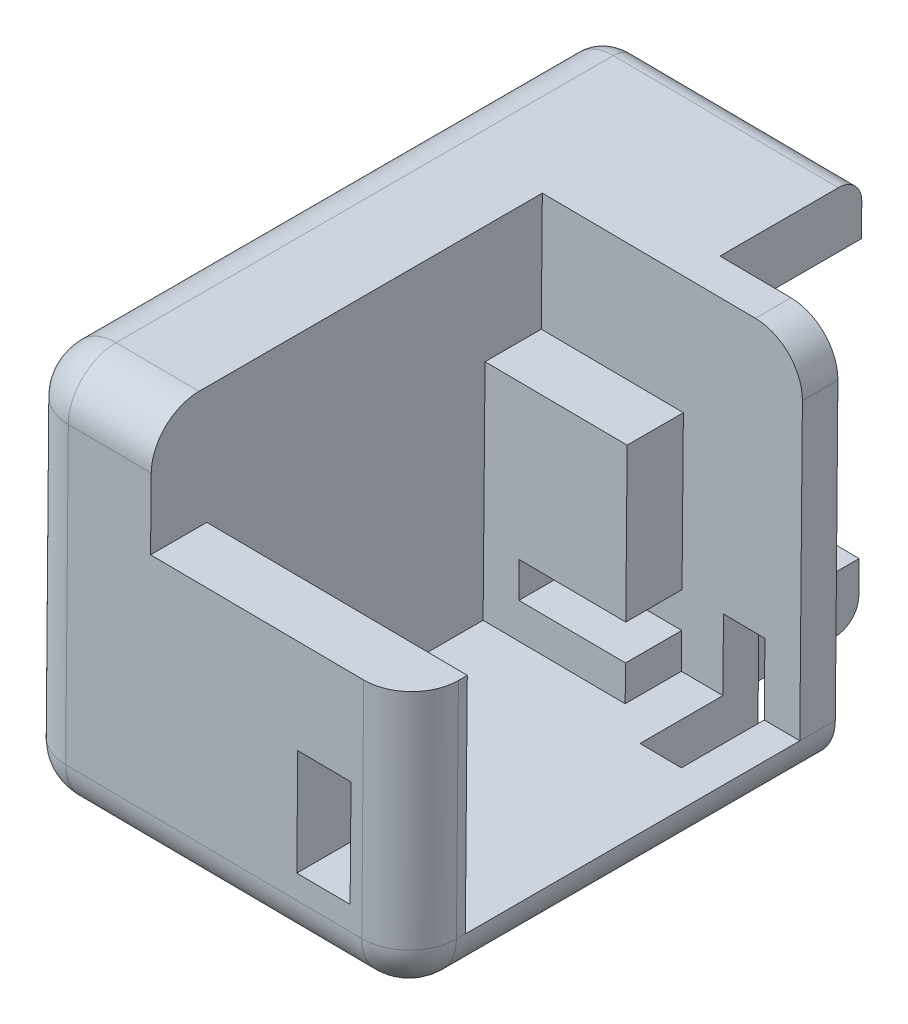
from build123d import *

# Parameters (mm, degrees)
BOSS_EXTRU_1_DEPTH           = 15
ESQUISSE2_W                  = 19
ESQUISSE2_H                  = 23.5
ENL_V_MAT_EXTRU_1_DEPTH      = 12
ESQUISSE6_W                  = 3
ESQUISSE6_H                  = 4.75
ENL_V_MAT_EXTRU_3_DEPTH      = 9
BOSS_EXTRU_2_START           = 33
BOSS_EXTRU_2_DEPTH           = 33
ENL_V_MAT_EXTRU_2_DEPTH      = 12
ESQUISSE7_W                  = 4.75
ESQUISSE7_H                  = 3
ENL_V_MAT_EXTRU_4_DEPTH      = 9
BOSS_EXTRU_3_DEPTH           = 10
ESQUISSE10_W                 = 4.5
ESQUISSE10_H                 = 9
ENL_V_MAT_EXTRU_5_DEPTH      = 10
ESQUISSE11_W                 = 3.5
ESQUISSE11_H                 = 10
ENL_V_MAT_EXTRU_6_DEPTH      = 10
CONG_2_R                     = 2
CONG_3_R                     = 4
CORPS_D_PLACER_COPIER1_ANGLE = 179.5


with BuildPart() as part:
    # Esquisse1 → Boss.-Extru.1 (new body)
    with BuildSketch(Plane(origin=(-30.750548051, -23.495381217, 0), x_dir=(-1, 0, 0), z_dir=(0, 0, -1))):
        with BuildLine():
            Line((-9.363526751, -30.819304804), (-9.363526751, 2.180695196))
            Line((-9.363526751, 2.180695196), (-28.363526751, 2.180695196))
            ThreePointArc((-28.363526751, 2.180695196), (-31.191953876, 1.009122321), (-32.363526751, -1.819304804))
            Line((-32.363526751, -1.819304804), (-32.363526751, -26.819304804))
            ThreePointArc((-32.363526751, -26.819304804), (-31.191953876, -29.647731929), (-28.363526751, -30.819304804))
            Line((-28.363526751, -30.819304804), (-9.363526751, -30.819304804))
        make_face()
    extrude(amount=BOSS_EXTRU_1_DEPTH)

    # Esquisse2 → Enlèv. mat.-Extru.1 (cut)
    with BuildSketch(Plane(origin=(0, 0, -15), x_dir=(-1, 0, 0), z_dir=(0, 0, -1))):
        with Locations((11.8870213, -37.814686021)):
            Rectangle(ESQUISSE2_W, ESQUISSE2_H)
    extrude(amount=-ENL_V_MAT_EXTRU_1_DEPTH, mode=Mode.SUBTRACT)

    # Esquisse6 → Enlèv. mat.-Extru.3 (cut)
    with BuildSketch(Plane(origin=(0, 0, -15), x_dir=(-1, 0, 0), z_dir=(0, 0, -1))):
        with Locations((6.8870213, -23.689686021)):
            Rectangle(ESQUISSE6_W, ESQUISSE6_H)
    extrude(amount=-ENL_V_MAT_EXTRU_3_DEPTH, mode=Mode.SUBTRACT)

    # Esquisse4 → Boss.-Extru.2 (add)
    with BuildSketch(Plane.XY.offset(BOSS_EXTRU_2_START)):
        with BuildLine():
            Line((-21.3870213, -54.314686021), (-21.3870213, -21.314686021))
            Line((-21.3870213, -21.314686021), (-2.3870213, -21.314686021))
            ThreePointArc((-2.3870213, -21.314686021), (0.441405825, -22.486258896), (1.6129787, -25.314686021))
            Line((1.6129787, -25.314686021), (1.6129787, -50.314686021))
            ThreePointArc((1.6129787, -50.314686021), (0.441405825, -53.143113146), (-2.3870213, -54.314686021))
            Line((-2.3870213, -54.314686021), (-21.3870213, -54.314686021))
        make_face()
    extrude(amount=-BOSS_EXTRU_2_DEPTH)

    # Esquisse5 → Enlèv. mat.-Extru.2 (cut)
    with BuildSketch(Plane.ZY.offset(21.3870213)):
        Polygon((0, -44.314686021), (4.75, -44.314686021), (4.75, -25.314686021), (28.25, -25.314686021), (28.25, -44.314686021), (33, -44.314686021), (33, -54.314686021), (0, -54.314686021), align=None)
    extrude(amount=-ENL_V_MAT_EXTRU_2_DEPTH, mode=Mode.SUBTRACT)

    # Esquisse7 → Enlèv. mat.-Extru.4 (cut)
    with BuildSketch(Plane.ZY.offset(21.3870213)):
        with Locations((2.375, -29.814686021)):
            Rectangle(ESQUISSE7_W, ESQUISSE7_H)
    extrude(amount=-ENL_V_MAT_EXTRU_4_DEPTH, mode=Mode.SUBTRACT)

    # Esquisse9 → Boss.-Extru.3 (add)
    with BuildSketch(Plane.ZY.offset(21.3870213)):
        Polygon((28.25, -44.314686021), (33, -44.314686021), (33, -21.314686021), (-3, -21.314686021), (-3, -54.314686021), (0, -54.314686021), (0, -25.314686021), (28.25, -25.314686021), align=None)
    extrude(amount=BOSS_EXTRU_3_DEPTH)

    # Esquisse10 → Enlèv. mat.-Extru.5 (cut)
    with BuildSketch(Plane.XY.offset(33)):
        with Locations((-24.1370213, -31.814686021)):
            Rectangle(ESQUISSE10_W, ESQUISSE10_H)
    extrude(amount=-ENL_V_MAT_EXTRU_5_DEPTH, mode=Mode.SUBTRACT)

    # Esquisse11 → Enlèv. mat.-Extru.6 (cut)
    with BuildSketch(Plane(origin=(0, 0, -3), x_dir=(-1, 0, 0), z_dir=(0, 0, -1))):
        with Locations((26.6370213, -26.314686021)):
            Rectangle(ESQUISSE11_W, ESQUISSE11_H)
    extrude(amount=-ENL_V_MAT_EXTRU_6_DEPTH, mode=Mode.SUBTRACT)

    # Congé2
    cong_2_edges = [part.edges().sort_by_distance(p)[0] for p in [
        (-14.8870213, -21.314686021, -15),
        (0.441405825, -22.486258896, -15),
        (1.6129787, -37.814686021, -15),
        (0.441405825, -53.143113146, -15),
        (-3.8870213, -21.314686021, -15),
        (-11.8870213, -54.314686021, -15),
    ]]
    fillet(cong_2_edges, radius=CONG_2_R)

    # Congé3
    cong_3_edges = [part.edges().sort_by_distance(p)[0] for p in [
        (-31.3870213, -21.314686021, 15),
        (-31.3870213, -54.314686021, -1.5),
        (1.6129787, -37.814686021, 33),
        (-16.8870213, -21.314686021, 33),
        (-5.8870213, -54.314686021, 33),
        (-31.3870213, -32.814686021, 33),
        (0.441405825, -53.143113146, 33),
        (0.441405825, -22.486258896, 33),
    ]]
    fillet(cong_3_edges, radius=CONG_3_R - 0.0001)  # a hair under: the kernel refuses the full size


with BuildPart() as part_1:
    # Corps-Déplacer/Copier1: moved
    add(part.part.rotate(Axis((-14.8870213, -37.814686021, 0), (0, 0, 1)), CORPS_D_PLACER_COPIER1_ANGLE))


solid = part_1.part
